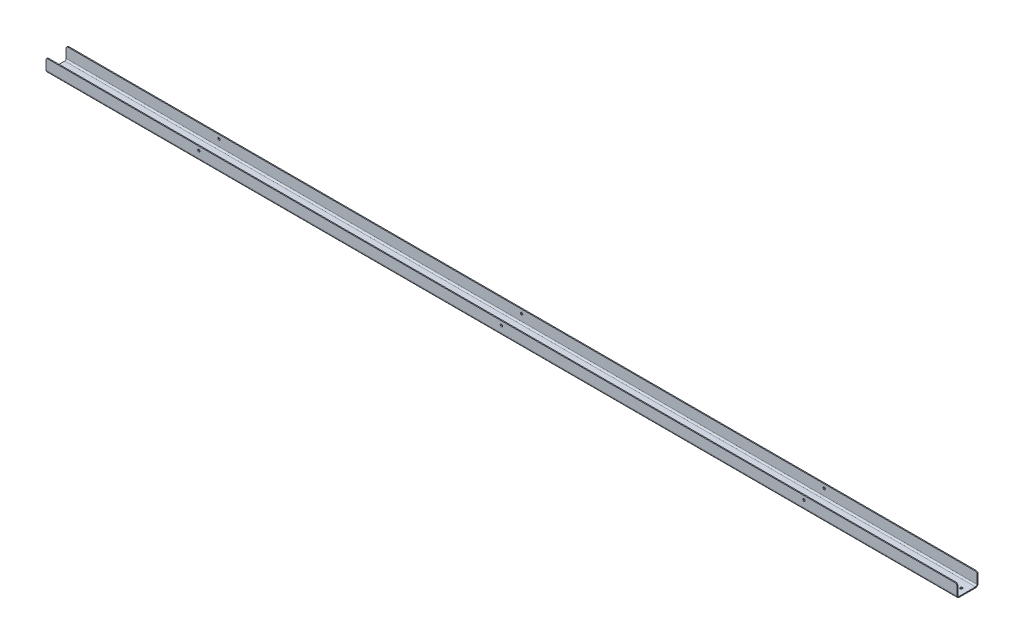
from build123d import *

# Parameters (mm, degrees)
BASE_FLANGE1_DEPTH = 1911.35
SKETCH2_R          = 2.4511
CUT_EXTRUDE1_DEPTH = 1913.06358148
SKETCH3_R          = 2.4511
CUT_EXTRUDE2_DEPTH = 1913.06358148
FILLET1_R          = 3.175


# Sheet-metal steps are written as plain solids
with BuildPart() as part:
    # Sketch1 → Base-Flange1 (new body)
    with BuildSketch(Plane(origin=(0, 0, 0), x_dir=(0, 0, -1), z_dir=(1, 0, 0))):
        with BuildLine():
            Line((0, 27.432), (0, 5.207))
            ThreePointArc((0, 5.207), (1.52509499, 1.52509499), (5.207, 0))
            Line((5.207, 0), (39.243, 0))
            ThreePointArc((39.243, 0), (42.92490501, 1.52509499), (44.45, 5.207))
            Line((44.45, 5.207), (44.45, 27.432))
            Line((44.45, 27.432), (42.418, 27.432))
            Line((42.418, 27.432), (42.418, 5.207))
            ThreePointArc((42.418, 5.207), (41.48806403, 2.96193597), (39.243, 2.032))
            Line((39.243, 2.032), (5.207, 2.032))
            ThreePointArc((5.207, 2.032), (2.96193597, 2.96193597), (2.032, 5.207))
            Line((2.032, 5.207), (2.032, 27.432))
            Line((2.032, 27.432), (0, 27.432))
        make_face()
    extrude(amount=BASE_FLANGE1_DEPTH)

    # Sketch2 → Cut-Extrude1 (cut, through all)
    with BuildSketch(Plane(origin=(0, 0, 0), x_dir=(-1, 0, 0), z_dir=(0, -1, 0))):
        with Locations(Location((-12.7, 22.225, 0), (0, 0, 90))):
            Circle(SKETCH2_R)
        with Locations(Location((-31.75, 22.225, 0), (0, 0, 90))):
            Circle(SKETCH2_R)
        with Locations(Location((-650.875, 22.225, 0), (0, 0, 90))):
            Circle(SKETCH2_R)
        with Locations(Location((-669.925, 22.225, 0), (0, 0, 90))):
            Circle(SKETCH2_R)
        with Locations(Location((-1898.65, 22.225, 0), (0, 0, 270))):
            Circle(SKETCH2_R)
        with Locations(Location((-1879.6, 22.225, 0), (0, 0, 270))):
            Circle(SKETCH2_R)
        with Locations(Location((-1260.475, 22.225, 0), (0, 0, 270))):
            Circle(SKETCH2_R)
        with Locations(Location((-1241.425, 22.225, 0), (0, 0, 270))):
            Circle(SKETCH2_R)
    extrude(amount=-CUT_EXTRUDE1_DEPTH, mode=Mode.SUBTRACT)

    # Sketch3 → Cut-Extrude2 (cut, through all)
    with BuildSketch(Plane(origin=(0, 0, -44.45), x_dir=(-1, 0, 0), z_dir=(0, 0, -1))):
        with Locations((-1590.675, 19.05)):
            Circle(SKETCH3_R)
        with Locations((-955.675, 19.05)):
            Circle(SKETCH3_R)
        with Locations((-320.675, 19.05)):
            Circle(SKETCH3_R)
    extrude(amount=-CUT_EXTRUDE2_DEPTH, mode=Mode.SUBTRACT)

    # Fillet1
    fillet1_edges = [part.edges().sort_by_distance(p)[0] for p in [
        (0, 27.432, -1.016),
        (0, 27.432, -43.434),
        (1911.35, 27.432, -1.016),
        (1911.35, 27.432, -43.434),
    ]]
    fillet(fillet1_edges, radius=FILLET1_R)


solid = part.part
